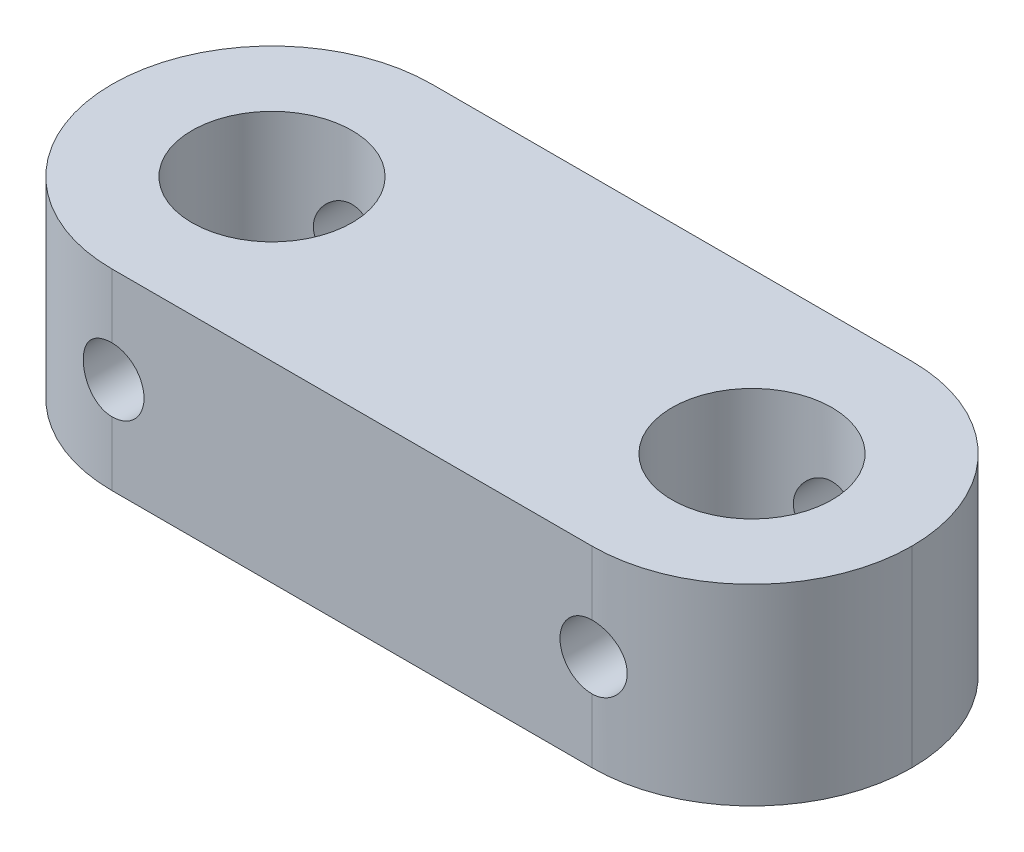
from build123d import *

# Parameters (mm, degrees)
SKETCH_1_W          = 75
SKETCH_1_H          = 18
EXTRUDE_1_DEPTH     = 30
SKETCH_9_R          = 7.5
CUT_EXTRUDE_6_DEPTH = 100
FILLET_1_R          = 15
SKETCH_10_R         = 7.5
CUT_EXTRUDE_7_DEPTH = 50
SKETCH_11_R         = 3
CUT_EXTRUDE_8_DEPTH = 60


with BuildPart() as part:
    # 草图1 → 拉伸1 (new body)
    with BuildSketch(Plane.XY):
        with Locations((37.5, -9)):
            Rectangle(SKETCH_1_W, SKETCH_1_H)
    extrude(amount=EXTRUDE_1_DEPTH)

    # 草图9 → 切除-拉伸6 (cut)
    with BuildSketch(Plane(origin=(0, 0, 0), x_dir=(1, 0, 0), z_dir=(0, 1, 0))):
        with Locations(Location((15, -15, 0), (0, 0, 270))):
            Circle(SKETCH_9_R)
    extrude(amount=-CUT_EXTRUDE_6_DEPTH, mode=Mode.SUBTRACT)

    # 圆角1
    fillet_1_edges = [part.edges().sort_by_distance(p)[0] for p in [
        (75, -9, 0),
        (75, -9, 30),
        (0, -9, 0),
        (0, -9, 30),
    ]]
    fillet(fillet_1_edges, radius=FILLET_1_R - 0.0001)  # a hair under: the kernel refuses the full size

    # 草图10 → 切除-拉伸7 (cut)
    with BuildSketch(Plane.XZ.offset(18)):
        with Locations(Location((60, 15, 0), (0, 0, 270))):
            Circle(SKETCH_10_R)
    extrude(amount=-CUT_EXTRUDE_7_DEPTH, mode=Mode.SUBTRACT)

    # 草图11 → 切除-拉伸8 (cut)
    with BuildSketch(Plane(origin=(0, 0, 0), x_dir=(-1, 0, 0), z_dir=(0, 0, -1))):
        with Locations((-60, -9)):
            Circle(SKETCH_11_R)
        with Locations((-15, -9)):
            Circle(SKETCH_11_R)
    extrude(amount=-CUT_EXTRUDE_8_DEPTH, mode=Mode.SUBTRACT)


solid = part.part
